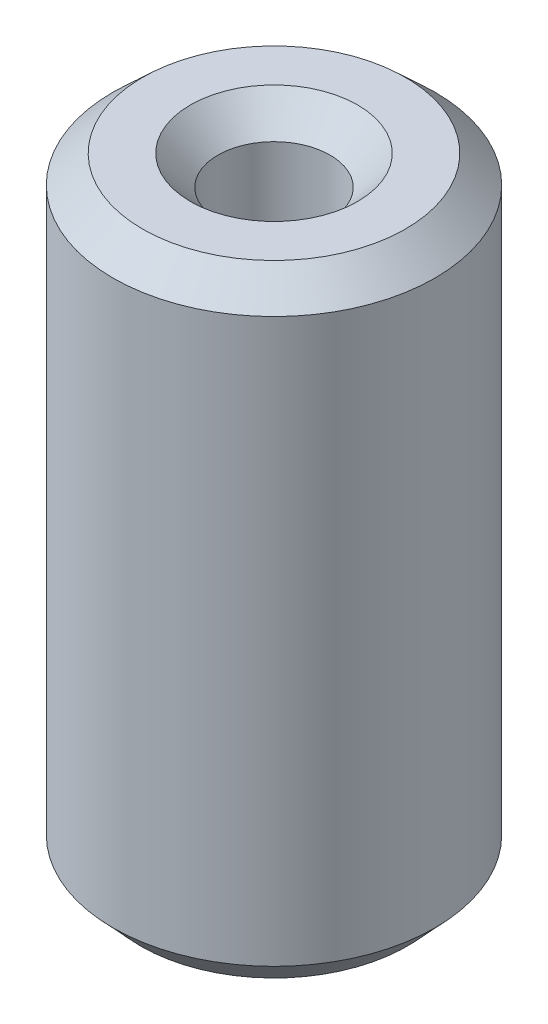
from build123d import *
from OCP.BRepFilletAPI import BRepFilletAPI_MakeChamfer

# Parameters (mm, degrees)
SKETCH1_R           = 12.5
BOSS_EXTRUDE1_DEPTH = 48.129699128
SKETCH2_R           = 4.351446433
CUT_EXTRUDE1_DEPTH  = 52.273462319
CHAMFER1_SIZE       = 2.142806131
CHAMFER1_SIZE2      = 2.298184823


with BuildPart() as part:
    # Sketch1 → Boss-Extrude1 (new body)
    with BuildSketch(Plane(origin=(0, 0, 0), x_dir=(1, 0, 0), z_dir=(0, 1, 0))):
        Circle(SKETCH1_R)
    extrude(amount=BOSS_EXTRUDE1_DEPTH)

    # Sketch2 → Cut-Extrude1 (cut, through all)
    with BuildSketch(Plane(origin=(0, 0, 0), x_dir=(1, 0, 0), z_dir=(0, 1, 0))):
        Circle(SKETCH2_R)
    extrude(amount=CUT_EXTRUDE1_DEPTH, mode=Mode.SUBTRACT)

    # Chamfer1: one chamfer whose edges measure the first distance from different faces: ONE call of the kernel's chamfer builder (chamfer() names one face for all edges)
    chamfer1_edges_1 = [part.edges().sort_by_distance(p)[0] for p in [
        (-4.351446433, 48.129699128, 0),
    ]]
    chamfer1_side_1 = [part.faces().sort_by_distance(p)[0] for p in [
        (-12.146446609, 48.129699128, 0),
    ]]
    chamfer1_edges_2 = [part.edges().sort_by_distance(p)[0] for p in [
        (-4.351446433, 0, 0),
    ]]
    chamfer1_side_2 = [part.faces().sort_by_distance(p)[0] for p in [
        (-4.351446433, 24.064849564, 0),
    ]]
    chamfer1_edges_3 = [part.edges().sort_by_distance(p)[0] for p in [
        (-12.5, 0, 0),
    ]]
    chamfer1_side_3 = [part.faces().sort_by_distance(p)[0] for p in [
        (-12.146446609, 0, 0),
    ]]
    chamfer1_edges_4 = [part.edges().sort_by_distance(p)[0] for p in [
        (-12.5, 48.129699128, 0),
    ]]
    chamfer1_side_4 = [part.faces().sort_by_distance(p)[0] for p in [
        (-12.5, 24.064849564, 0),
    ]]
    chamfer1 = BRepFilletAPI_MakeChamfer(part.part.solid().wrapped)
    for e in chamfer1_edges_1:
        chamfer1.Add(CHAMFER1_SIZE, CHAMFER1_SIZE2, e.wrapped, chamfer1_side_1[0].wrapped)  # the first distance lies on this face
    for e in chamfer1_edges_2:
        chamfer1.Add(CHAMFER1_SIZE, CHAMFER1_SIZE2, e.wrapped, chamfer1_side_2[0].wrapped)  # the first distance lies on this face
    for e in chamfer1_edges_3:
        chamfer1.Add(CHAMFER1_SIZE, CHAMFER1_SIZE2, e.wrapped, chamfer1_side_3[0].wrapped)  # the first distance lies on this face
    for e in chamfer1_edges_4:
        chamfer1.Add(CHAMFER1_SIZE, CHAMFER1_SIZE2, e.wrapped, chamfer1_side_4[0].wrapped)  # the first distance lies on this face
    add(Compound.cast(chamfer1.Shape()), mode=Mode.REPLACE)


solid = part.part
